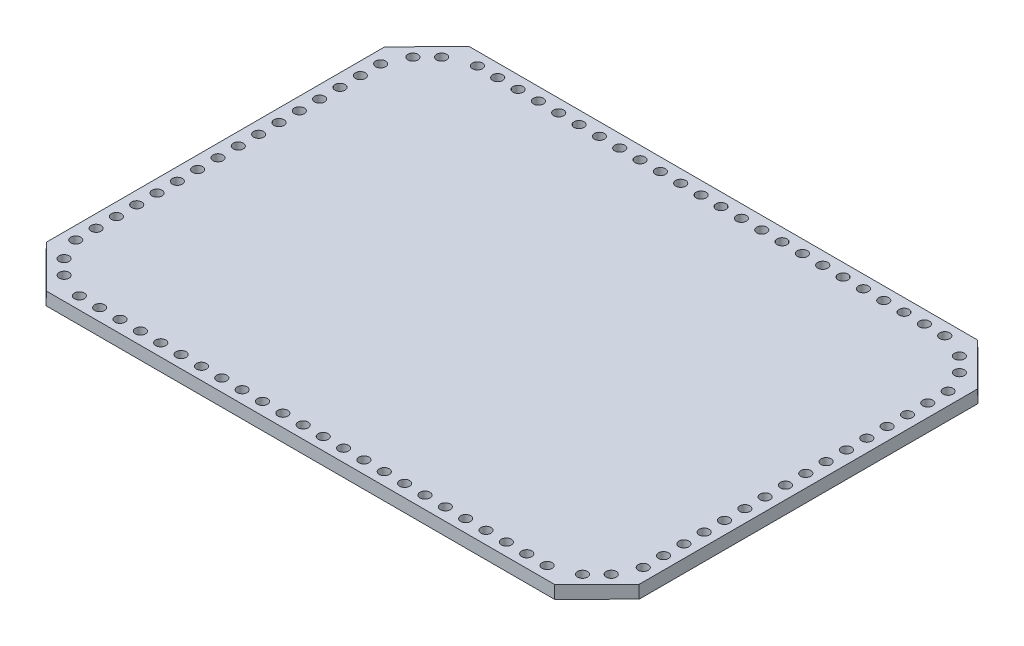
from build123d import *
from OCP.BRepFilletAPI import BRepFilletAPI_MakeChamfer

# Parameters (mm, degrees)
SKETCH2_W                = 177.8
SKETCH2_H                = 127
BOSS_EXTRUDE2_DEPTH      = 3.81
BOSS_EXTRUDE2_TAPER      = 1
CHAMFER2_SIZE            = 12.7
CHAMFER2_SIZE2           = 12.703870016
SKETCH15_R               = 1.5
CUT_EXTRUDE3_DEPTH       = 25.4
CIRPATTERN3_COUNT        = 2
SKETCH16_R               = 1.5
CUT_EXTRUDE4_DEPTH       = 25.4
LPATTERN1_COUNT          = 12
LPATTERN1_PITCH          = 6.096
MIRROR1_COPY_1_SKETCH_R  = 1.5
MIRROR1_COPY_1_DEPTH     = 25.4
MIRROR1_COPY_2_SKETCH_R  = 1.5
MIRROR1_COPY_2_DEPTH     = 25.4
MIRROR1_COPY_3_SKETCH_R  = 1.5
MIRROR1_COPY_3_DEPTH     = 25.4
MIRROR1_COPY_4_SKETCH_R  = 1.5
MIRROR1_COPY_4_DEPTH     = 25.4
MIRROR1_COPY_5_SKETCH_R  = 1.5
MIRROR1_COPY_5_DEPTH     = 25.4
MIRROR1_COPY_6_SKETCH_R  = 1.5
MIRROR1_COPY_6_DEPTH     = 25.4
MIRROR1_COPY_7_SKETCH_R  = 1.5
MIRROR1_COPY_7_DEPTH     = 25.4
MIRROR1_COPY_8_SKETCH_R  = 1.5
MIRROR1_COPY_8_DEPTH     = 25.4
MIRROR1_COPY_9_SKETCH_R  = 1.5
MIRROR1_COPY_9_DEPTH     = 25.4
MIRROR1_COPY_10_SKETCH_R = 1.5
MIRROR1_COPY_10_DEPTH    = 25.4
MIRROR1_COPY_11_SKETCH_R = 1.5
MIRROR1_COPY_11_DEPTH    = 25.4
MIRROR2_COPY_1_SKETCH_R  = 1.5
MIRROR2_COPY_1_DEPTH     = 25.4
MIRROR2_COPY_2_SKETCH_R  = 1.5
MIRROR2_COPY_2_DEPTH     = 25.4
MIRROR2_COPY_3_SKETCH_R  = 1.5
MIRROR2_COPY_3_DEPTH     = 25.4
MIRROR2_COPY_4_SKETCH_R  = 1.5
MIRROR2_COPY_4_DEPTH     = 25.4
MIRROR2_COPY_5_SKETCH_R  = 1.5
MIRROR2_COPY_5_DEPTH     = 25.4
MIRROR2_COPY_6_SKETCH_R  = 1.5
MIRROR2_COPY_6_DEPTH     = 25.4
MIRROR2_COPY_7_SKETCH_R  = 1.5
MIRROR2_COPY_7_DEPTH     = 25.4
MIRROR2_COPY_8_SKETCH_R  = 1.5
MIRROR2_COPY_8_DEPTH     = 25.4
MIRROR2_COPY_9_SKETCH_R  = 1.5
MIRROR2_COPY_9_DEPTH     = 25.4
MIRROR2_COPY_10_SKETCH_R = 1.5
MIRROR2_COPY_10_DEPTH    = 25.4
MIRROR2_COPY_11_SKETCH_R = 1.5
MIRROR2_COPY_11_DEPTH    = 25.4
MIRROR2_COPY_12_SKETCH_R = 1.5
MIRROR2_COPY_12_DEPTH    = 25.4
MIRROR2_COPY_13_SKETCH_R = 1.5
MIRROR2_COPY_13_DEPTH    = 25.4
MIRROR2_COPY_14_SKETCH_R = 1.5
MIRROR2_COPY_14_DEPTH    = 25.4
MIRROR2_COPY_15_SKETCH_R = 1.5
MIRROR2_COPY_15_DEPTH    = 25.4
MIRROR2_COPY_16_SKETCH_R = 1.5
MIRROR2_COPY_16_DEPTH    = 25.4
MIRROR2_COPY_17_SKETCH_R = 1.5
MIRROR2_COPY_17_DEPTH    = 25.4
MIRROR2_COPY_18_SKETCH_R = 1.5
MIRROR2_COPY_18_DEPTH    = 25.4
MIRROR2_COPY_19_SKETCH_R = 1.5
MIRROR2_COPY_19_DEPTH    = 25.4
MIRROR2_COPY_20_SKETCH_R = 1.5
MIRROR2_COPY_20_DEPTH    = 25.4
MIRROR2_COPY_21_SKETCH_R = 1.5
MIRROR2_COPY_21_DEPTH    = 25.4
MIRROR2_COPY_22_SKETCH_R = 1.5
MIRROR2_COPY_22_DEPTH    = 25.4
MIRROR2_COPY_23_SKETCH_R = 1.5
MIRROR2_COPY_23_DEPTH    = 25.4
MIRROR3_OUTLINE_R        = 1.5
MIRROR3_DEPTH            = 3.81
SKETCH17_R               = 1.5
CUT_EXTRUDE5_DEPTH       = 25.4
LPATTERN2_COUNT          = 8
LPATTERN2_PITCH          = 6.096
MIRROR4_COPY_1_SKETCH_R  = 1.5
MIRROR4_COPY_1_DEPTH     = 25.4
MIRROR4_COPY_2_SKETCH_R  = 1.5
MIRROR4_COPY_2_DEPTH     = 25.4
MIRROR4_COPY_3_SKETCH_R  = 1.5
MIRROR4_COPY_3_DEPTH     = 25.4
MIRROR4_COPY_4_SKETCH_R  = 1.5
MIRROR4_COPY_4_DEPTH     = 25.4
MIRROR4_COPY_5_SKETCH_R  = 1.5
MIRROR4_COPY_5_DEPTH     = 25.4
MIRROR4_COPY_6_SKETCH_R  = 1.5
MIRROR4_COPY_6_DEPTH     = 25.4
MIRROR4_COPY_7_SKETCH_R  = 1.5
MIRROR4_COPY_7_DEPTH     = 25.4


# Read off the part's stored shape, not the designer's step: Mirror3
with BuildPart() as part:
    # Sketch2 → Boss-Extrude2 (new body)
    with BuildSketch(Plane(origin=(0, 0, 0), x_dir=(1, 0, 0), z_dir=(0, 1, 0))):
        with Locations((3.014153783, -5.872043011)):
            Rectangle(SKETCH2_W, SKETCH2_H)
    extrude(amount=BOSS_EXTRUDE2_DEPTH, taper=BOSS_EXTRUDE2_TAPER)

    # Chamfer2: one chamfer whose edges measure the first distance from different faces: ONE call of the kernel's chamfer builder (chamfer() names one face for all edges)
    chamfer2_edges_1 = [part.edges().sort_by_distance(p)[0] for p in [
        (-85.852594319, 1.905, -57.594705091),
    ]]
    chamfer2_side_1 = [part.faces().sort_by_distance(p)[0] for p in [
        (3.014153783, 1.904762398, -57.594709238),
    ]]
    chamfer2_edges_2 = [part.edges().sort_by_distance(p)[0] for p in [
        (91.880901884, 1.905, -57.594705091),
    ]]
    chamfer2_side_2 = [part.faces().sort_by_distance(p)[0] for p in [
        (91.880907691, 1.904667307, 5.872043011),
    ]]
    chamfer2_edges_3 = [part.edges().sort_by_distance(p)[0] for p in [
        (91.880901884, 1.905, 69.338791112),
    ]]
    chamfer2_side_3 = [part.faces().sort_by_distance(p)[0] for p in [
        (3.014153783, 1.904762398, 69.338795259),
    ]]
    chamfer2_edges_4 = [part.edges().sort_by_distance(p)[0] for p in [
        (-85.852594319, 1.905, 69.338791112),
    ]]
    chamfer2_side_4 = [part.faces().sort_by_distance(p)[0] for p in [
        (-85.852600126, 1.904667307, 5.872043011),
    ]]
    chamfer2 = BRepFilletAPI_MakeChamfer(part.part.solid().wrapped)
    for e in chamfer2_edges_1:
        chamfer2.Add(CHAMFER2_SIZE, CHAMFER2_SIZE2, e.wrapped, chamfer2_side_1[0].wrapped)  # the first distance lies on this face
    for e in chamfer2_edges_2:
        chamfer2.Add(CHAMFER2_SIZE, CHAMFER2_SIZE2, e.wrapped, chamfer2_side_2[0].wrapped)  # the first distance lies on this face
    for e in chamfer2_edges_3:
        chamfer2.Add(CHAMFER2_SIZE, CHAMFER2_SIZE2, e.wrapped, chamfer2_side_3[0].wrapped)  # the first distance lies on this face
    for e in chamfer2_edges_4:
        chamfer2.Add(CHAMFER2_SIZE, CHAMFER2_SIZE2, e.wrapped, chamfer2_side_4[0].wrapped)  # the first distance lies on this face
    add(Compound.cast(chamfer2.Shape()), mode=Mode.REPLACE)

    # Sketch15 → Cut-Extrude3 (cut)
    with BuildSketch(Plane(origin=(0, 3.81, 0), x_dir=(1, 0, 0), z_dir=(0, 1, 0))):
        with Locations(Location((-74.620332931, 50.669096035, 0), (0, 0, 270))):
            Circle(SKETCH15_R)
        with Locations(Location((-78.930199205, 46.357916433, 0), (0, 0, 270))):
            Circle(SKETCH15_R)
    cut_extrude3 = extrude(amount=-CUT_EXTRUDE3_DEPTH, mode=Mode.SUBTRACT)

    # CirPattern3: Cut-Extrude3 ×2 about axis
    cirpattern3_axis = Axis((3.06495719, 0, 5.906671301), (0, 1, 0))
    for i in range(1, CIRPATTERN3_COUNT):
        add(cut_extrude3.rotate(cirpattern3_axis, i * 360 / CIRPATTERN3_COUNT), mode=Mode.SUBTRACT)

    # Sketch16 → Cut-Extrude4 (cut)
    with BuildSketch(Plane(origin=(0, 3.81, 0), x_dir=(1, 0, 0), z_dir=(0, 1, 0))):
        with Locations(Location((6.063385444, 53.751453192, 0), (0, 0, 270))):
            Circle(SKETCH16_R)
    cut_extrude4 = extrude(amount=-CUT_EXTRUDE4_DEPTH, mode=Mode.SUBTRACT)

    # LPattern1: Cut-Extrude4 ×12
    with Locations(*[(i * LPATTERN1_PITCH, 0, 0) for i in range(1, LPATTERN1_COUNT)]):
        add(cut_extrude4, mode=Mode.SUBTRACT)

    # Mirror1: Cut-Extrude4 across plane
    add(cut_extrude4.mirror(Plane.ZY.offset(-3.06495719)), mode=Mode.SUBTRACT)

    # Mirror1 copy 1 sketch → Mirror1 copy 1 (cut)
    with BuildSketch(Plane(origin=(0.033914381, 3.81, 0), x_dir=(-1, 0, 0), z_dir=(0, 1, 0))):
        with Locations((6.063385444, -53.751453192)):
            Circle(MIRROR1_COPY_1_SKETCH_R)
    extrude(amount=-MIRROR1_COPY_1_DEPTH, mode=Mode.SUBTRACT)

    # Mirror1 copy 2 sketch → Mirror1 copy 2 (cut)
    with BuildSketch(Plane(origin=(-6.062085619, 3.81, 0), x_dir=(-1, 0, 0), z_dir=(0, 1, 0))):
        with Locations((6.063385444, -53.751453192)):
            Circle(MIRROR1_COPY_2_SKETCH_R)
    extrude(amount=-MIRROR1_COPY_2_DEPTH, mode=Mode.SUBTRACT)

    # Mirror1 copy 3 sketch → Mirror1 copy 3 (cut)
    with BuildSketch(Plane(origin=(-12.158085619, 3.81, 0), x_dir=(-1, 0, 0), z_dir=(0, 1, 0))):
        with Locations((6.063385444, -53.751453192)):
            Circle(MIRROR1_COPY_3_SKETCH_R)
    extrude(amount=-MIRROR1_COPY_3_DEPTH, mode=Mode.SUBTRACT)

    # Mirror1 copy 4 sketch → Mirror1 copy 4 (cut)
    with BuildSketch(Plane(origin=(-18.254085619, 3.81, 0), x_dir=(-1, 0, 0), z_dir=(0, 1, 0))):
        with Locations((6.063385444, -53.751453192)):
            Circle(MIRROR1_COPY_4_SKETCH_R)
    extrude(amount=-MIRROR1_COPY_4_DEPTH, mode=Mode.SUBTRACT)

    # Mirror1 copy 5 sketch → Mirror1 copy 5 (cut)
    with BuildSketch(Plane(origin=(-24.350085619, 3.81, 0), x_dir=(-1, 0, 0), z_dir=(0, 1, 0))):
        with Locations((6.063385444, -53.751453192)):
            Circle(MIRROR1_COPY_5_SKETCH_R)
    extrude(amount=-MIRROR1_COPY_5_DEPTH, mode=Mode.SUBTRACT)

    # Mirror1 copy 6 sketch → Mirror1 copy 6 (cut)
    with BuildSketch(Plane(origin=(-30.446085619, 3.81, 0), x_dir=(-1, 0, 0), z_dir=(0, 1, 0))):
        with Locations((6.063385444, -53.751453192)):
            Circle(MIRROR1_COPY_6_SKETCH_R)
    extrude(amount=-MIRROR1_COPY_6_DEPTH, mode=Mode.SUBTRACT)

    # Mirror1 copy 7 sketch → Mirror1 copy 7 (cut)
    with BuildSketch(Plane(origin=(-36.542085619, 3.81, 0), x_dir=(-1, 0, 0), z_dir=(0, 1, 0))):
        with Locations((6.063385444, -53.751453192)):
            Circle(MIRROR1_COPY_7_SKETCH_R)
    extrude(amount=-MIRROR1_COPY_7_DEPTH, mode=Mode.SUBTRACT)

    # Mirror1 copy 8 sketch → Mirror1 copy 8 (cut)
    with BuildSketch(Plane(origin=(-42.638085619, 3.81, 0), x_dir=(-1, 0, 0), z_dir=(0, 1, 0))):
        with Locations((6.063385444, -53.751453192)):
            Circle(MIRROR1_COPY_8_SKETCH_R)
    extrude(amount=-MIRROR1_COPY_8_DEPTH, mode=Mode.SUBTRACT)

    # Mirror1 copy 9 sketch → Mirror1 copy 9 (cut)
    with BuildSketch(Plane(origin=(-48.734085619, 3.81, 0), x_dir=(-1, 0, 0), z_dir=(0, 1, 0))):
        with Locations((6.063385444, -53.751453192)):
            Circle(MIRROR1_COPY_9_SKETCH_R)
    extrude(amount=-MIRROR1_COPY_9_DEPTH, mode=Mode.SUBTRACT)

    # Mirror1 copy 10 sketch → Mirror1 copy 10 (cut)
    with BuildSketch(Plane(origin=(-54.830085619, 3.81, 0), x_dir=(-1, 0, 0), z_dir=(0, 1, 0))):
        with Locations((6.063385444, -53.751453192)):
            Circle(MIRROR1_COPY_10_SKETCH_R)
    extrude(amount=-MIRROR1_COPY_10_DEPTH, mode=Mode.SUBTRACT)

    # Mirror1 copy 11 sketch → Mirror1 copy 11 (cut)
    with BuildSketch(Plane(origin=(-60.926085619, 3.81, 0), x_dir=(-1, 0, 0), z_dir=(0, 1, 0))):
        with Locations((6.063385444, -53.751453192)):
            Circle(MIRROR1_COPY_11_SKETCH_R)
    extrude(amount=-MIRROR1_COPY_11_DEPTH, mode=Mode.SUBTRACT)

    # Mirror2: Cut-Extrude4 across plane
    add(cut_extrude4.mirror(Plane(origin=(0.002433078, 0, 5.907932548), x_dir=(0.999999915197029, 0, -0.00041183241088167666), z_dir=(0.00041183241088167666, 0, 0.9999999151970291))), mode=Mode.SUBTRACT)

    # Mirror2 copy 1 sketch → Mirror2 copy 1 (cut)
    with BuildSketch(Plane(origin=(6.100864089, 3.81, 11.810844036), x_dir=(0.9999996607881307, 0, -0.0008236647519141295), z_dir=(0, 1, 0))):
        with Locations((6.063385444, -53.751453192)):
            Circle(MIRROR2_COPY_1_SKETCH_R)
    extrude(amount=-MIRROR2_COPY_1_DEPTH, mode=Mode.SUBTRACT)

    # Mirror2 copy 2 sketch → Mirror2 copy 2 (cut)
    with BuildSketch(Plane(origin=(12.196862021, 3.81, 11.805822976), x_dir=(0.9999996607881307, 0, -0.0008236647519141295), z_dir=(0, 1, 0))):
        with Locations((6.063385444, -53.751453192)):
            Circle(MIRROR2_COPY_2_SKETCH_R)
    extrude(amount=-MIRROR2_COPY_2_DEPTH, mode=Mode.SUBTRACT)

    # Mirror2 copy 3 sketch → Mirror2 copy 3 (cut)
    with BuildSketch(Plane(origin=(18.292859953, 3.81, 11.800801915), x_dir=(0.9999996607881307, 0, -0.0008236647519141295), z_dir=(0, 1, 0))):
        with Locations((6.063385444, -53.751453192)):
            Circle(MIRROR2_COPY_3_SKETCH_R)
    extrude(amount=-MIRROR2_COPY_3_DEPTH, mode=Mode.SUBTRACT)

    # Mirror2 copy 4 sketch → Mirror2 copy 4 (cut)
    with BuildSketch(Plane(origin=(24.388857885, 3.81, 11.795780855), x_dir=(0.9999996607881307, 0, -0.0008236647519141295), z_dir=(0, 1, 0))):
        with Locations((6.063385444, -53.751453192)):
            Circle(MIRROR2_COPY_4_SKETCH_R)
    extrude(amount=-MIRROR2_COPY_4_DEPTH, mode=Mode.SUBTRACT)

    # Mirror2 copy 5 sketch → Mirror2 copy 5 (cut)
    with BuildSketch(Plane(origin=(30.484855817, 3.81, 11.790759795), x_dir=(0.9999996607881307, 0, -0.0008236647519141295), z_dir=(0, 1, 0))):
        with Locations((6.063385444, -53.751453192)):
            Circle(MIRROR2_COPY_5_SKETCH_R)
    extrude(amount=-MIRROR2_COPY_5_DEPTH, mode=Mode.SUBTRACT)

    # Mirror2 copy 6 sketch → Mirror2 copy 6 (cut)
    with BuildSketch(Plane(origin=(36.58085375, 3.81, 11.785738734), x_dir=(0.9999996607881307, 0, -0.0008236647519141295), z_dir=(0, 1, 0))):
        with Locations((6.063385444, -53.751453192)):
            Circle(MIRROR2_COPY_6_SKETCH_R)
    extrude(amount=-MIRROR2_COPY_6_DEPTH, mode=Mode.SUBTRACT)

    # Mirror2 copy 7 sketch → Mirror2 copy 7 (cut)
    with BuildSketch(Plane(origin=(42.676851682, 3.81, 11.780717674), x_dir=(0.9999996607881307, 0, -0.0008236647519141295), z_dir=(0, 1, 0))):
        with Locations((6.063385444, -53.751453192)):
            Circle(MIRROR2_COPY_7_SKETCH_R)
    extrude(amount=-MIRROR2_COPY_7_DEPTH, mode=Mode.SUBTRACT)

    # Mirror2 copy 8 sketch → Mirror2 copy 8 (cut)
    with BuildSketch(Plane(origin=(48.772849614, 3.81, 11.775696614), x_dir=(0.9999996607881307, 0, -0.0008236647519141295), z_dir=(0, 1, 0))):
        with Locations((6.063385444, -53.751453192)):
            Circle(MIRROR2_COPY_8_SKETCH_R)
    extrude(amount=-MIRROR2_COPY_8_DEPTH, mode=Mode.SUBTRACT)

    # Mirror2 copy 9 sketch → Mirror2 copy 9 (cut)
    with BuildSketch(Plane(origin=(54.868847546, 3.81, 11.770675553), x_dir=(0.9999996607881307, 0, -0.0008236647519141295), z_dir=(0, 1, 0))):
        with Locations((6.063385444, -53.751453192)):
            Circle(MIRROR2_COPY_9_SKETCH_R)
    extrude(amount=-MIRROR2_COPY_9_DEPTH, mode=Mode.SUBTRACT)

    # Mirror2 copy 10 sketch → Mirror2 copy 10 (cut)
    with BuildSketch(Plane(origin=(60.964845478, 3.81, 11.765654493), x_dir=(0.9999996607881307, 0, -0.0008236647519141295), z_dir=(0, 1, 0))):
        with Locations((6.063385444, -53.751453192)):
            Circle(MIRROR2_COPY_10_SKETCH_R)
    extrude(amount=-MIRROR2_COPY_10_DEPTH, mode=Mode.SUBTRACT)

    # Mirror2 copy 11 sketch → Mirror2 copy 11 (cut)
    with BuildSketch(Plane(origin=(67.06084341, 3.81, 11.760633433), x_dir=(0.9999996607881307, 0, -0.0008236647519141295), z_dir=(0, 1, 0))):
        with Locations((6.063385444, -53.751453192)):
            Circle(MIRROR2_COPY_11_SKETCH_R)
    extrude(amount=-MIRROR2_COPY_11_DEPTH, mode=Mode.SUBTRACT)

    # Mirror2 copy 12 sketch → Mirror2 copy 12 (cut)
    with BuildSketch(Plane(origin=(6.134778458, 3.81, 11.810816102), x_dir=(-0.9999996607881307, 0, 0.0008236647519141295), z_dir=(0, 1, 0))):
        with Locations(Location((6.063385444, 53.751453192, 0), (0, 0, 270))):
            Circle(MIRROR2_COPY_12_SKETCH_R)
    extrude(amount=-MIRROR2_COPY_12_DEPTH, mode=Mode.SUBTRACT)

    # Mirror2 copy 13 sketch → Mirror2 copy 13 (cut)
    with BuildSketch(Plane(origin=(0.038780526, 3.81, 11.815837162), x_dir=(-0.9999996607881307, 0, 0.0008236647519141295), z_dir=(0, 1, 0))):
        with Locations(Location((6.063385444, 53.751453192, 0), (0, 0, 270))):
            Circle(MIRROR2_COPY_13_SKETCH_R)
    extrude(amount=-MIRROR2_COPY_13_DEPTH, mode=Mode.SUBTRACT)

    # Mirror2 copy 14 sketch → Mirror2 copy 14 (cut)
    with BuildSketch(Plane(origin=(-6.057217407, 3.81, 11.820858223), x_dir=(-0.9999996607881307, 0, 0.0008236647519141295), z_dir=(0, 1, 0))):
        with Locations(Location((6.063385444, 53.751453192, 0), (0, 0, 270))):
            Circle(MIRROR2_COPY_14_SKETCH_R)
    extrude(amount=-MIRROR2_COPY_14_DEPTH, mode=Mode.SUBTRACT)

    # Mirror2 copy 15 sketch → Mirror2 copy 15 (cut)
    with BuildSketch(Plane(origin=(-12.153215339, 3.81, 11.825879283), x_dir=(-0.9999996607881307, 0, 0.0008236647519141295), z_dir=(0, 1, 0))):
        with Locations(Location((6.063385444, 53.751453192, 0), (0, 0, 270))):
            Circle(MIRROR2_COPY_15_SKETCH_R)
    extrude(amount=-MIRROR2_COPY_15_DEPTH, mode=Mode.SUBTRACT)

    # Mirror2 copy 16 sketch → Mirror2 copy 16 (cut)
    with BuildSketch(Plane(origin=(-18.249213271, 3.81, 11.830900343), x_dir=(-0.9999996607881307, 0, 0.0008236647519141295), z_dir=(0, 1, 0))):
        with Locations(Location((6.063385444, 53.751453192, 0), (0, 0, 270))):
            Circle(MIRROR2_COPY_16_SKETCH_R)
    extrude(amount=-MIRROR2_COPY_16_DEPTH, mode=Mode.SUBTRACT)

    # Mirror2 copy 17 sketch → Mirror2 copy 17 (cut)
    with BuildSketch(Plane(origin=(-24.345211203, 3.81, 11.835921404), x_dir=(-0.9999996607881307, 0, 0.0008236647519141295), z_dir=(0, 1, 0))):
        with Locations(Location((6.063385444, 53.751453192, 0), (0, 0, 270))):
            Circle(MIRROR2_COPY_17_SKETCH_R)
    extrude(amount=-MIRROR2_COPY_17_DEPTH, mode=Mode.SUBTRACT)

    # Mirror2 copy 18 sketch → Mirror2 copy 18 (cut)
    with BuildSketch(Plane(origin=(-30.441209135, 3.81, 11.840942464), x_dir=(-0.9999996607881307, 0, 0.0008236647519141295), z_dir=(0, 1, 0))):
        with Locations(Location((6.063385444, 53.751453192, 0), (0, 0, 270))):
            Circle(MIRROR2_COPY_18_SKETCH_R)
    extrude(amount=-MIRROR2_COPY_18_DEPTH, mode=Mode.SUBTRACT)

    # Mirror2 copy 19 sketch → Mirror2 copy 19 (cut)
    with BuildSketch(Plane(origin=(-36.537207067, 3.81, 11.845963524), x_dir=(-0.9999996607881307, 0, 0.0008236647519141295), z_dir=(0, 1, 0))):
        with Locations(Location((6.063385444, 53.751453192, 0), (0, 0, 270))):
            Circle(MIRROR2_COPY_19_SKETCH_R)
    extrude(amount=-MIRROR2_COPY_19_DEPTH, mode=Mode.SUBTRACT)

    # Mirror2 copy 20 sketch → Mirror2 copy 20 (cut)
    with BuildSketch(Plane(origin=(-42.633205, 3.81, 11.850984585), x_dir=(-0.9999996607881307, 0, 0.0008236647519141295), z_dir=(0, 1, 0))):
        with Locations(Location((6.063385444, 53.751453192, 0), (0, 0, 270))):
            Circle(MIRROR2_COPY_20_SKETCH_R)
    extrude(amount=-MIRROR2_COPY_20_DEPTH, mode=Mode.SUBTRACT)

    # Mirror2 copy 21 sketch → Mirror2 copy 21 (cut)
    with BuildSketch(Plane(origin=(-48.729202932, 3.81, 11.856005645), x_dir=(-0.9999996607881307, 0, 0.0008236647519141295), z_dir=(0, 1, 0))):
        with Locations(Location((6.063385444, 53.751453192, 0), (0, 0, 270))):
            Circle(MIRROR2_COPY_21_SKETCH_R)
    extrude(amount=-MIRROR2_COPY_21_DEPTH, mode=Mode.SUBTRACT)

    # Mirror2 copy 22 sketch → Mirror2 copy 22 (cut)
    with BuildSketch(Plane(origin=(-54.825200864, 3.81, 11.861026705), x_dir=(-0.9999996607881307, 0, 0.0008236647519141295), z_dir=(0, 1, 0))):
        with Locations(Location((6.063385444, 53.751453192, 0), (0, 0, 270))):
            Circle(MIRROR2_COPY_22_SKETCH_R)
    extrude(amount=-MIRROR2_COPY_22_DEPTH, mode=Mode.SUBTRACT)

    # Mirror2 copy 23 sketch → Mirror2 copy 23 (cut)
    with BuildSketch(Plane(origin=(-60.921198796, 3.81, 11.866047766), x_dir=(-0.9999996607881307, 0, 0.0008236647519141295), z_dir=(0, 1, 0))):
        with Locations(Location((6.063385444, 53.751453192, 0), (0, 0, 270))):
            Circle(MIRROR2_COPY_23_SKETCH_R)
    extrude(amount=-MIRROR2_COPY_23_DEPTH, mode=Mode.SUBTRACT)

    # Mirror3 outline → Mirror3 (cut)
    with BuildSketch(Plane(origin=(0, 0, 0), x_dir=(1, 0, 0), z_dir=(0, 1, 0))):
        with Locations((84.91301618, 46.354928189)):
            Circle(MIRROR3_OUTLINE_R)
        with Locations((80.599600401, 50.662556443)):
            Circle(MIRROR3_OUTLINE_R)
        with Locations((-78.887122893, -58.238777827)):
            Circle(MIRROR3_OUTLINE_R)
        with Locations((-74.573707113, -62.546406082)):
            Circle(MIRROR3_OUTLINE_R)
    extrude(amount=MIRROR3_DEPTH, mode=Mode.SUBTRACT)

    # Sketch17 → Cut-Extrude5 (cut)
    with BuildSketch(Plane(origin=(0, 3.81, 0), x_dir=(1, 0, 0), z_dir=(0, 1, 0))):
        with Locations(Location((-82.00934242, -2.8937074, 0), (0, 0, 270))):
            Circle(SKETCH17_R)
        with Locations(Location((88.037649985, -2.823676531, 0), (0, 0, 270))):
            Circle(SKETCH17_R)
    cut_extrude5 = extrude(amount=-CUT_EXTRUDE5_DEPTH, mode=Mode.SUBTRACT)

    # LPattern2: Cut-Extrude5 ×8
    with Locations(*[(0, 0, -i * LPATTERN2_PITCH) for i in range(1, LPATTERN2_COUNT)]):
        add(cut_extrude5, mode=Mode.SUBTRACT)

    # Mirror4: Cut-Extrude5 across plane
    add(cut_extrude5.mirror(Plane(origin=(0.002433078, 0, 5.907932548), x_dir=(0.999999915197029, 0, -0.00041183241088167666), z_dir=(0.00041183241088167666, 0, 0.9999999151970291))), mode=Mode.SUBTRACT)

    # Mirror4 copy 1 sketch → Mirror4 copy 1 (cut)
    with BuildSketch(Plane(origin=(0.009887217, 3.81, 17.911863028), x_dir=(0.9999996607881307, 0, -0.0008236647519141295), z_dir=(0, 1, 0))):
        with Locations((-82.00934242, 2.8937074)):
            Circle(MIRROR4_COPY_1_SKETCH_R)
        with Locations((88.037649985, 2.823676531)):
            Circle(MIRROR4_COPY_1_SKETCH_R)
    extrude(amount=-MIRROR4_COPY_1_DEPTH, mode=Mode.SUBTRACT)

    # Mirror4 copy 2 sketch → Mirror4 copy 2 (cut)
    with BuildSketch(Plane(origin=(0.014908277, 3.81, 24.007860961), x_dir=(0.9999996607881307, 0, -0.0008236647519141295), z_dir=(0, 1, 0))):
        with Locations((-82.00934242, 2.8937074)):
            Circle(MIRROR4_COPY_2_SKETCH_R)
        with Locations((88.037649985, 2.823676531)):
            Circle(MIRROR4_COPY_2_SKETCH_R)
    extrude(amount=-MIRROR4_COPY_2_DEPTH, mode=Mode.SUBTRACT)

    # Mirror4 copy 3 sketch → Mirror4 copy 3 (cut)
    with BuildSketch(Plane(origin=(0.019929338, 3.81, 30.103858893), x_dir=(0.9999996607881307, 0, -0.0008236647519141295), z_dir=(0, 1, 0))):
        with Locations((-82.00934242, 2.8937074)):
            Circle(MIRROR4_COPY_3_SKETCH_R)
        with Locations((88.037649985, 2.823676531)):
            Circle(MIRROR4_COPY_3_SKETCH_R)
    extrude(amount=-MIRROR4_COPY_3_DEPTH, mode=Mode.SUBTRACT)

    # Mirror4 copy 4 sketch → Mirror4 copy 4 (cut)
    with BuildSketch(Plane(origin=(0.024950398, 3.81, 36.199856825), x_dir=(0.9999996607881307, 0, -0.0008236647519141295), z_dir=(0, 1, 0))):
        with Locations((-82.00934242, 2.8937074)):
            Circle(MIRROR4_COPY_4_SKETCH_R)
        with Locations((88.037649985, 2.823676531)):
            Circle(MIRROR4_COPY_4_SKETCH_R)
    extrude(amount=-MIRROR4_COPY_4_DEPTH, mode=Mode.SUBTRACT)

    # Mirror4 copy 5 sketch → Mirror4 copy 5 (cut)
    with BuildSketch(Plane(origin=(0.029971458, 3.81, 42.295854757), x_dir=(0.9999996607881307, 0, -0.0008236647519141295), z_dir=(0, 1, 0))):
        with Locations((-82.00934242, 2.8937074)):
            Circle(MIRROR4_COPY_5_SKETCH_R)
        with Locations((88.037649985, 2.823676531)):
            Circle(MIRROR4_COPY_5_SKETCH_R)
    extrude(amount=-MIRROR4_COPY_5_DEPTH, mode=Mode.SUBTRACT)

    # Mirror4 copy 6 sketch → Mirror4 copy 6 (cut)
    with BuildSketch(Plane(origin=(0.034992519, 3.81, 48.391852689), x_dir=(0.9999996607881307, 0, -0.0008236647519141295), z_dir=(0, 1, 0))):
        with Locations((-82.00934242, 2.8937074)):
            Circle(MIRROR4_COPY_6_SKETCH_R)
        with Locations((88.037649985, 2.823676531)):
            Circle(MIRROR4_COPY_6_SKETCH_R)
    extrude(amount=-MIRROR4_COPY_6_DEPTH, mode=Mode.SUBTRACT)

    # Mirror4 copy 7 sketch → Mirror4 copy 7 (cut)
    with BuildSketch(Plane(origin=(0.040013579, 3.81, 54.487850621), x_dir=(0.9999996607881307, 0, -0.0008236647519141295), z_dir=(0, 1, 0))):
        with Locations((-82.00934242, 2.8937074)):
            Circle(MIRROR4_COPY_7_SKETCH_R)
        with Locations((88.037649985, 2.823676531)):
            Circle(MIRROR4_COPY_7_SKETCH_R)
    extrude(amount=-MIRROR4_COPY_7_DEPTH, mode=Mode.SUBTRACT)


solid = part.part
